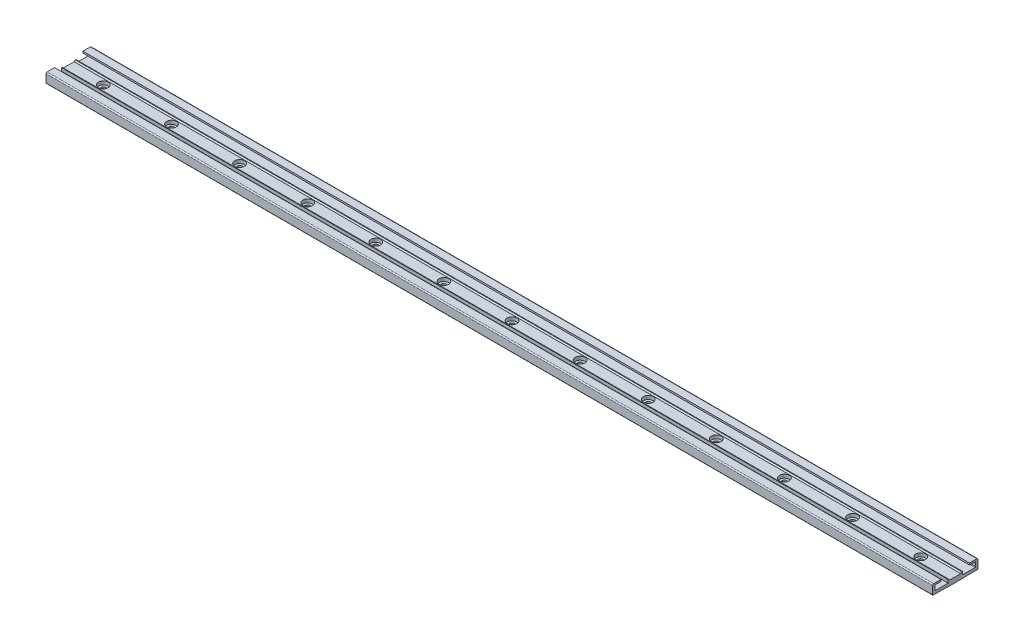
from build123d import *

# Parameters (mm, degrees)
BOSS_EXTRUDE1_DEPTH             = 781.05
CBORE_FOR_M4_SBHCS1_D           = 4.5
CBORE_FOR_M4_SBHCS1_CBORE_D     = 8.6
CBORE_FOR_M4_SBHCS1_CBORE_DEPTH = 3.1
LPATTERN1_COUNT                 = 13
LPATTERN1_PITCH                 = 60


with BuildPart() as part:
    # Sketch1 → Boss-Extrude1 (new body)
    with BuildSketch(Plane(origin=(0, 0, 0), x_dir=(0, 0, -1), z_dir=(1, 0, 0))):
        with BuildLine():
            Line((-8, 0.2), (-8, 0))
            Line((-8, 0), (8, 0))
            Line((8, 0), (8, 0.2))
            Line((8, 0.2), (19.5, 0.2))
            ThreePointArc((19.5, 0.2), (19.853553391, 0.346446609), (20, 0.7))
            Line((20, 0.7), (20, 7.7))
            ThreePointArc((20, 7.7), (19.707106781, 8.407106781), (19, 8.7))
            Line((19, 8.7), (12.5, 8.7))
            Line((12.5, 8.7), (12.5, 7.2))
            Line((12.5, 7.2), (17.5, 7.2))
            ThreePointArc((17.5, 7.2), (17.853553391, 7.053553391), (18, 6.7))
            Line((18, 6.7), (18, 3.3))
            ThreePointArc((18, 3.3), (17.853553391, 2.946446609), (17.5, 2.8))
            Line((17.5, 2.8), (6.3, 2.8))
            Line((6.3, 2.8), (6.3, 5.5))
            Line((6.3, 5.5), (5.75, 5.5))
            Line((5.75, 5.5), (4.75, 4.5))
            Line((4.75, 4.5), (-4.75, 4.5))
            Line((-4.75, 4.5), (-5.75, 5.5))
            Line((-5.75, 5.5), (-6.3, 5.5))
            Line((-6.3, 5.5), (-6.3, 2.8))
            Line((-6.3, 2.8), (-17.5, 2.8))
            ThreePointArc((-17.5, 2.8), (-17.853553391, 2.946446609), (-18, 3.3))
            Line((-18, 3.3), (-18, 6.7))
            ThreePointArc((-18, 6.7), (-17.853553391, 7.053553391), (-17.5, 7.2))
            Line((-17.5, 7.2), (-12.5, 7.2))
            Line((-12.5, 7.2), (-12.5, 8.7))
            Line((-12.5, 8.7), (-19, 8.7))
            ThreePointArc((-19, 8.7), (-19.707106781, 8.407106781), (-20, 7.7))
            Line((-20, 7.7), (-20, 0.7))
            ThreePointArc((-20, 0.7), (-19.853553391, 0.346446609), (-19.5, 0.2))
            Line((-19.5, 0.2), (-8, 0.2))
        make_face()
    extrude(amount=BOSS_EXTRUDE1_DEPTH)

    # CBORE for M4 SBHCS1 (through all)
    with Locations(Plane(origin=(0, 4.5, 0), x_dir=(1, 0, 0), z_dir=(0, 1, 0))):
        with Locations((30.525, 0)):
            cbore_for_m4_sbhcs1 = CounterBoreHole(CBORE_FOR_M4_SBHCS1_D / 2, CBORE_FOR_M4_SBHCS1_CBORE_D / 2, CBORE_FOR_M4_SBHCS1_CBORE_DEPTH)

    # LPattern1: CBORE for M4 SBHCS1 ×13
    with Locations(*[(i * LPATTERN1_PITCH, 0, 0) for i in range(1, LPATTERN1_COUNT)]):
        add(cbore_for_m4_sbhcs1, mode=Mode.SUBTRACT)


solid = part.part
